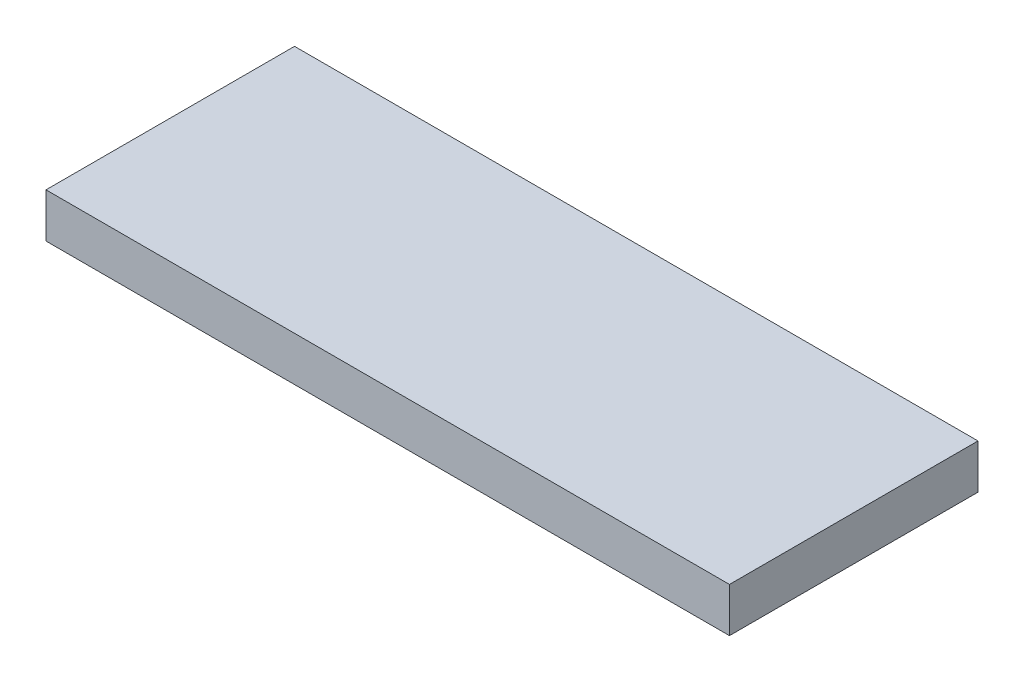
from build123d import *

# Parameters (mm, degrees)
SKETCH1_W                  = 154
SKETCH1_H                  = 56
BASE_DEPTH                 = 10
SKETCH2_R                  = 5.8
LOAD_CELL_BUTTON_CUT_DEPTH = 5.2


with BuildPart() as part:
    # Sketch1 → base (new body)
    with BuildSketch(Plane(origin=(0, 0, 0), x_dir=(1, 0, 0), z_dir=(0, 1, 0))):
        Rectangle(SKETCH1_W, SKETCH1_H)
    extrude(amount=BASE_DEPTH)

    # Sketch2 → load cell button cut (cut)
    with BuildSketch(Plane.XZ):
        Circle(SKETCH2_R)
    extrude(amount=-LOAD_CELL_BUTTON_CUT_DEPTH, mode=Mode.SUBTRACT)


solid = part.part
